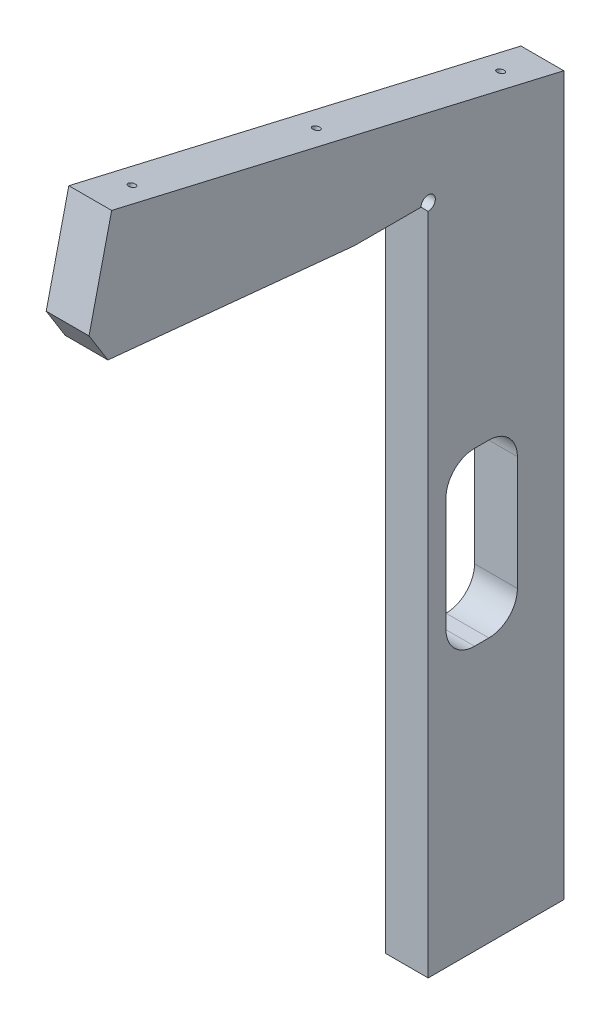
from build123d import *

# Parameters (mm, degrees)
BOSS_EXTRUDE1_DEPTH = 19.05
BOSS_EXTRUDE2_DEPTH = 19.05
CHAMFER1_SIZE       = 12.7
CHAMFER1_SIZE2      = 11.325028866
SKETCH12_W          = 31.75
SKETCH12_H          = 76.2
CUT_EXTRUDE1_DEPTH  = 367.085742005
FILLET1_R           = 12.7


# Read off the part's stored shape, not the designer's step: Hole3, Hole4
with BuildPart() as part:
    # Sketch2 → Boss-Extrude1 (new body)
    with BuildSketch(Plane(origin=(-113.788766336, 0, 0), x_dir=(0, 0, -1), z_dir=(1, 0, 0))):
        with BuildLine():
            Line((0, 20.824633003), (-83.828599938, 40.306941911))
            Line((-83.828599938, 40.306941911), (-93.196193981, 0))
            Line((-93.196193981, 0), (-63.5, 0))
            ThreePointArc((-63.5, 0), (-58.07993597, 2.24506403), (-60.325, -3.175))
            Line((-60.325, -3.175), (-60.325, -298.45))
            Line((-60.325, -298.45), (0, -298.45))
            Line((0, -298.45), (0, 20.824633003))
        make_face()
    extrude(amount=BOSS_EXTRUDE1_DEPTH)

    # Sketch3 → Boss-Extrude2 (add, through all)
    with BuildSketch(Plane.ZY.offset(113.788766336)):
        Polygon((83.828599938, 40.306941911), (201.08567571, 67.558244849), (214.022912031, 11.891823944), (93.196193981, 0), align=None)
    extrude(amount=-BOSS_EXTRUDE2_DEPTH)

    # Chamfer1
    chamfer1_edges = [part.edges().sort_by_distance(p)[0] for p in [
        (-104.263766336, 11.891823944, 214.022912031),
    ]]
    chamfer1_side = [part.faces().sort_by_distance(p)[0] for p in [
        (-104.263766336, 39.725034397, 207.554293871),
    ]]
    chamfer(chamfer1_edges, length=CHAMFER1_SIZE, length2=CHAMFER1_SIZE2, reference=chamfer1_side[0])

    # Hole3 outline → Hole3 (revolve, cut)
    with BuildSketch(Plane(origin=(-104.263766336, 5.379568105, 23.147239101), x_dir=(1, 0, 0), z_dir=(0, 0.22637333895091205, 0.9740406107612842))):
        Polygon((0, 0.280172016), (1.5875, 1.234038249), (1.5875, 20.284038249), (0, 20.284038249), align=None)
    revolve(axis=Axis((-104.263766336, 5.379568105, 23.147239101), (0, 0.9740406107612842, -0.22637333895091205)), mode=Mode.SUBTRACT)

    # Hole3 2 outline → Hole3 2 (revolve, cut)
    with BuildSketch(Plane(origin=(-104.263766336, 24.433961921, 105.134603321), x_dir=(1, 0, 0), z_dir=(0, 0.22637333895091205, 0.9740406107612842))):
        Polygon((0, 0.280172016), (1.5875, 1.234038249), (1.5875, 20.284038249), (0, 20.284038249), align=None)
    revolve(axis=Axis((-104.263766336, 24.433961921, 105.134603321), (0, 0.9740406107612842, -0.22637333895091205)), mode=Mode.SUBTRACT)

    # Hole3 3 outline → Hole3 3 (revolve, cut)
    with BuildSketch(Plane(origin=(-104.263766336, 43.488355737, 187.121967541), x_dir=(1, 0, 0), z_dir=(0, 0.22637333895091205, 0.9740406107612842))):
        Polygon((0, 0.280172016), (1.5875, 1.234038249), (1.5875, 20.284038249), (0, 20.284038249), align=None)
    revolve(axis=Axis((-104.263766336, 43.488355737, 187.121967541), (0, 0.9740406107612842, -0.22637333895091205)), mode=Mode.SUBTRACT)

    # Hole4 outline → Hole4 (revolve, cut)
    with BuildSketch(Plane(origin=(-104.263766336, -279.4, 0), x_dir=(1, 0, 0), z_dir=(0, -1, 0))):
        Polygon((1.5875, 0), (1.5875, 12.7), (0, 13.653866233), (0, 0), align=None)
    revolve(axis=Axis((-104.263766336, -279.4, 0), (0, 0, 1)), mode=Mode.SUBTRACT)

    # Hole4 2 outline → Hole4 2 (revolve, cut)
    with BuildSketch(Plane(origin=(-104.263766336, -149.225, 0), x_dir=(1, 0, 0), z_dir=(0, -1, 0))):
        Polygon((1.5875, 0), (1.5875, 12.7), (0, 13.653866233), (0, 0), align=None)
    revolve(axis=Axis((-104.263766336, -149.225, 0), (0, 0, 1)), mode=Mode.SUBTRACT)

    # Hole4 3 outline → Hole4 3 (revolve, cut)
    with BuildSketch(Plane(origin=(-104.263766336, -19.05, 0), x_dir=(1, 0, 0), z_dir=(0, -1, 0))):
        Polygon((1.5875, 0), (1.5875, 12.7), (0, 13.653866233), (0, 0), align=None)
    revolve(axis=Axis((-104.263766336, -19.05, 0), (0, 0, 1)), mode=Mode.SUBTRACT)

    # Sketch12 → Cut-Extrude1 (cut, through all)
    with BuildSketch(Plane(origin=(-94.738766336, 0, 0), x_dir=(0, 0, -1), z_dir=(1, 0, 0))):
        with Locations((-36.5125, -142.875)):
            Rectangle(SKETCH12_W, SKETCH12_H)
    extrude(amount=-CUT_EXTRUDE1_DEPTH, mode=Mode.SUBTRACT)

    # Fillet1
    fillet1_edges = [part.edges().sort_by_distance(p)[0] for p in [
        (-104.263766336, -104.775, 20.6375),
        (-104.263766336, -180.975, 20.6375),
        (-104.263766336, -180.975, 52.3875),
        (-104.263766336, -104.775, 52.3875),
    ]]
    fillet(fillet1_edges, radius=FILLET1_R)


solid = part.part
